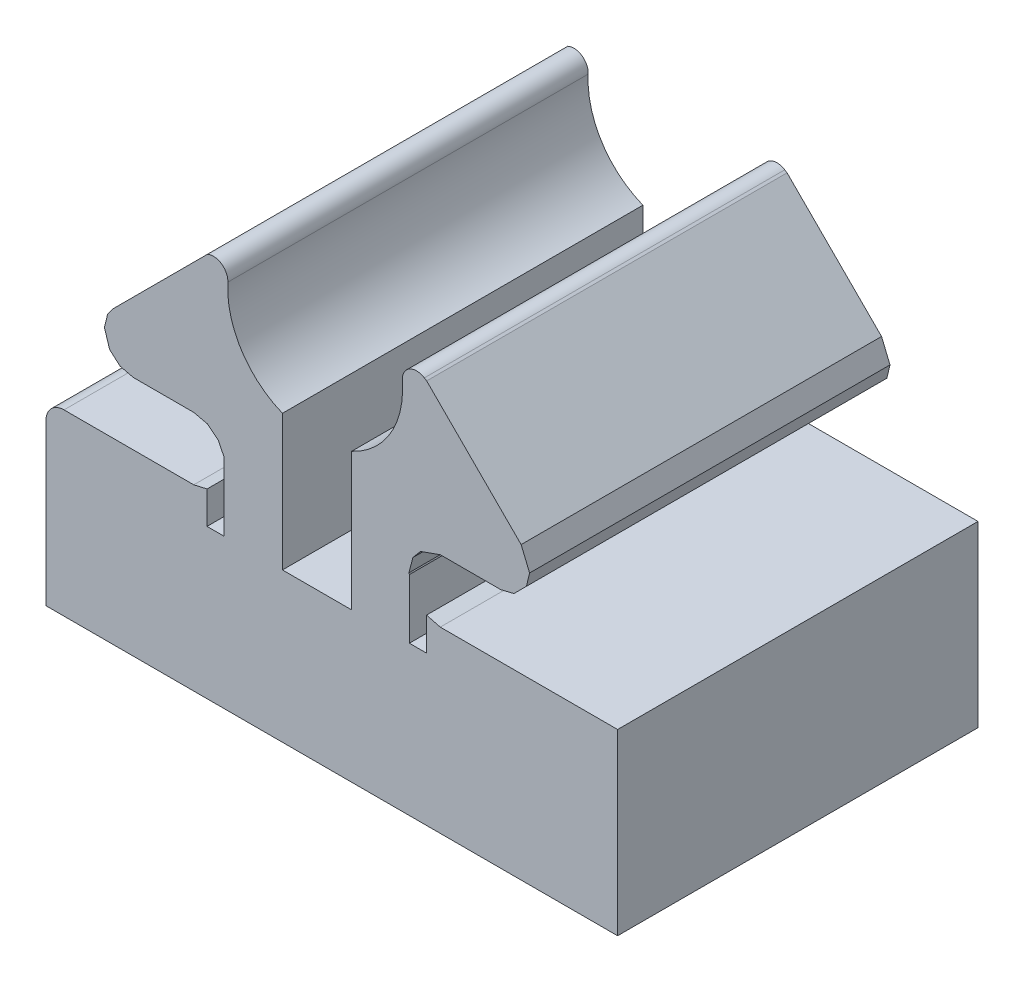
from build123d import *

# Parameters (mm, degrees)
BOSS_EXTRUDE1_DEPTH = 12.7
SKETCH10_R          = 3.082136138
CUT_EXTRUDE1_DEPTH  = 26.185474767
SKETCH11_W          = 2.435876878
SKETCH11_H          = 7.908405343
CUT_EXTRUDE2_DEPTH  = 26.185474767
FILLET1_R           = 0.635
FILLET3_R           = 0.508
SKETCH17_W          = 0.605016918
SKETCH17_H          = 2.095446093
SKETCH17_W_2        = 0.604461085
SKETCH17_H_2        = 2.141007526
CUT_EXTRUDE7_DEPTH  = 26.185474767
SKETCH18_R          = 5.08
CUT_EXTRUDE8_DEPTH  = 2.794


with BuildPart() as part:
    # Sketch5 → Boss-Extrude1 (new body)
    with BuildSketch(Plane.XY):
        Polygon((-6.474794456, -10.4902), (-6.938297275, -10.378313453), (-7.308763147, -10.05450356), (-7.490794456, -9.4742), (-7.378907909, -9.01069718), (-7.193214945, -8.75577951), (-3.863171405, -5.42573597), (-2.833127272, -4.737482484), (-1.618107374, -4.4958), (1.618107374, -4.4958), (2.668236067, -4.674493152), (3.863171405, -5.42573597), (7.193214945, -8.75577951), (7.490794456, -9.4742), (7.378907909, -9.93770282), (6.938297275, -10.378313453), (6.474794456, -10.4902), (4.3434, -10.4902), (3.646537163, -10.737670005), (3.377082754, -11.059343535), (3.2385, -11.5951), (3.485970005, -12.291962837), (3.807643535, -12.561417246), (4.3434, -12.7), (10.5918, -12.7), (10.5918, -18.995576116), (-9.5504, -18.995576116), (-9.5504, -12.7), (-4.3434, -12.7), (-3.863171405, -12.590180165), (-3.485969976, -12.291962837), (-3.271081829, -11.861441531), (-3.271081829, -11.328758469), (-3.485969976, -10.898237163), (-3.863171405, -10.600019835), (-4.3434, -10.4902), align=None)
    extrude(amount=-BOSS_EXTRUDE1_DEPTH)

    # Sketch10 → Cut-Extrude1 (cut, through all)
    with BuildSketch(Plane.XY):
        with Locations((-0.066530556, -6.095976424)):
            Circle(SKETCH10_R)
    extrude(amount=-CUT_EXTRUDE1_DEPTH, mode=Mode.SUBTRACT)

    # Sketch11 → Cut-Extrude2 (cut, through all)
    with BuildSketch(Plane.XY):
        with Locations((0, -9.781904855)):
            Rectangle(SKETCH11_W, SKETCH11_H)
    extrude(amount=-CUT_EXTRUDE2_DEPTH, mode=Mode.SUBTRACT)

    # Fillet1
    fillet1_edges = [part.edges().sort_by_distance(p)[0] for p in [
        (-9.5504, -12.7, -6.35),
    ]]
    fillet(fillet1_edges, radius=FILLET1_R)

    # Fillet3
    # the kernel refuses this fillet: 0.508 mm, written as the material it takes off along each edge
    with BuildSketch(Plane(origin=(2.668236067, -4.674493152, 3.28944818), x_dir=(0.8465916632907232, -0.5322429479538895, 0), z_dir=(0, 0, -1))) as fillet3_piece_1:
        with BuildLine():
            CenterArc((1.315779272, 0.508), FILLET3_R, 143.192029884, 126.807970116)
            Line((0.90905007, 0.812360569), (0.900915486, 0.81844778))
            ThreePointArc((0.900915486, 0.81844778), (0.488321858, 0.368360866), (-0.005137978, 0.008765089))
            Line((-0.005137978, 0.008765089), (0, -0.01016))
            Line((0, -0.01016), (1.315779272, -0.01016))
            Line((1.315779272, -0.01016), (1.315779272, 0))
        make_face()
    extrude(amount=19.278896361, mode=Mode.SUBTRACT)
    with BuildSketch(Plane(origin=(-2.833127272, -4.737482484, 3.097058862), x_dir=(-0.8314696122997464, -0.5555702330237908, 0), z_dir=(0, 0, -1))) as fillet3_piece_2:
        with BuildLine():
            CenterArc((1.31839441, -0.501729486), FILLET3_R, 99.011665767, 118.073467257)
            Line((0.913142276, -0.808054001), (0.905037233, -0.814180491))
            ThreePointArc((0.905037233, -0.814180491), (0.490196501, -0.366028623), (-0.005094947, -0.008790172))
            Line((-0.005094947, -0.008790172), (0, 0.01016))
            ThreePointArc((0, 0.01016), (0.619411772, 0.01016), (1.237232128, 0.01003459))
            Line((1.237232128, 0.01003459), (1.238823545, 0))
        make_face()
    extrude(amount=18.894117724, mode=Mode.SUBTRACT)

    # Sketch17 → Cut-Extrude7 (cut, through all)
    with BuildSketch(Plane.XY):
        with Locations((3.55718824, -12.68838448)):
            Rectangle(SKETCH17_W, SKETCH17_H)
        with Locations((-3.573312372, -12.665603763)):
            Rectangle(SKETCH17_W_2, SKETCH17_H_2)
    extrude(amount=-CUT_EXTRUDE7_DEPTH, mode=Mode.SUBTRACT)

    # Sketch18 → Cut-Extrude8 (cut)
    with BuildSketch(Plane.XZ.offset(18.995576116)):
        with Locations((0, -6.35)):
            Circle(SKETCH18_R)
    extrude(amount=-CUT_EXTRUDE8_DEPTH, mode=Mode.SUBTRACT)


solid = part.part
